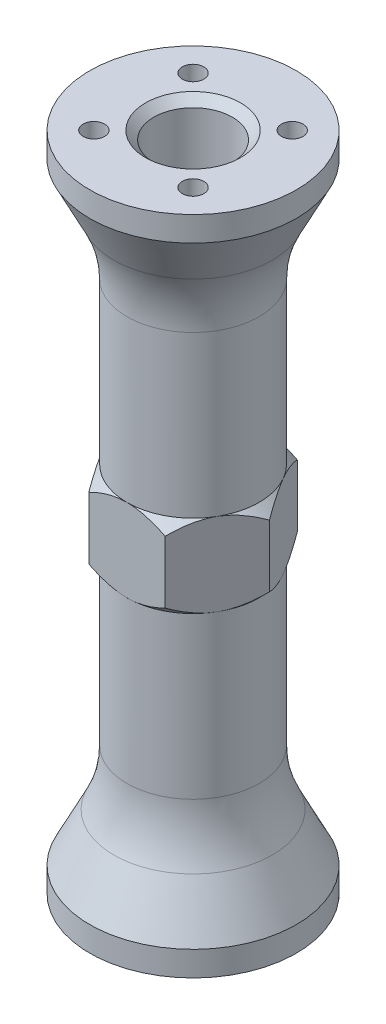
from build123d import *

# Parameters (mm, degrees)
SKETCH2_R           = 1.3
CUT_EXTRUDE1_DEPTH  = 7
SKETCH4_R           = 4.75
CUT_EXTRUDE2_DEPTH  = 82.929848041
FILLET1_R           = 15
FILLET2_R           = 4
SKETCH5_R           = 7
BOSS_EXTRUDE1_DEPTH = 5
CHAMFER1_SIZE       = 1


with BuildPart() as part:
    # Sketch1 → Revolve1 (revolve)
    with BuildSketch(Plane.XY, mode=Mode.PRIVATE) as revolve1_sk:
        Polygon((0, -40), (0, 40), (-12.5, 40), (-12.5, 37), (-8, 28), (-8, -28), (-12.5, -37), (-12.5, -40), align=None)
    revolve(revolve1_sk.sketch.rotate(Axis((0, -40, 0), (0, 1, 0)), 270), axis=Axis((0, -40, 0), (0, 1, 0)))

    # Sketch2 → Cut-Extrude1 (cut)
    with BuildSketch(Plane(origin=(0, 40, 0), x_dir=(1, 0, 0), z_dir=(0, 1, 0))):
        with Locations(Location((-6, 6, 0), (0, 0, 270))):
            Circle(SKETCH2_R)
        with Locations(Location((6, 6, 0), (0, 0, 270))):
            Circle(SKETCH2_R)
        with Locations(Location((-6, -6, 0), (0, 0, 270))):
            Circle(SKETCH2_R)
        with Locations(Location((6, -6, 0), (0, 0, 270))):
            Circle(SKETCH2_R)
    cut_extrude1 = extrude(amount=-CUT_EXTRUDE1_DEPTH, mode=Mode.SUBTRACT)

    # Mirror1: Cut-Extrude1 across plane
    add(cut_extrude1.mirror(Plane.ZX), mode=Mode.SUBTRACT)

    # Sketch3 → Cut-Revolve1 (revolve, cut)
    with BuildSketch(Plane(origin=(0, 0, 0), x_dir=(0, 0, -1), z_dir=(1, 0, 0))):
        Polygon((-5, 31.7), (0, 36.7), (0, -36.7), (-5, -31.7), align=None)
    revolve(axis=Axis((0, 36.7, 0), (0, -1, 0)), mode=Mode.SUBTRACT)

    # Sketch4 → Cut-Extrude2 (cut, through all)
    with BuildSketch(Plane(origin=(0, 40, 0), x_dir=(1, 0, 0), z_dir=(0, 1, 0))):
        with Locations(Location((0, 0, 0), (0, 0, 270))):
            Circle(SKETCH4_R)
    extrude(amount=-CUT_EXTRUDE2_DEPTH, mode=Mode.SUBTRACT)

    # Fillet1
    fillet1_edges = [part.edges().sort_by_distance(p)[0] for p in [
        (0, -28, 8),
        (0, 28, 8),
    ]]
    fillet(fillet1_edges, radius=FILLET1_R)

    # Fillet2
    # the kernel refuses this fillet: 4 mm, written as the material it adds along each edge
    with BuildSketch(Plane(origin=(0, 31.7, 0), x_dir=(0, 0, 1), z_dir=(1, 0, 0))) as fillet2_piece_1:
        with BuildLine():
            CenterArc((1, 1.141941091), FILLET2_R, 339.635865194, 20.364134806)
            Line((5, 1.141941091), (5.08, 1.141941091))
            Line((5.08, 1.141941091), (5.08, 0))
            Line((5.08, 0), (5.056568542, -0.056568542))
            ThreePointArc((5.056568542, -0.056568542), (4.931568542, -0.181568542), (4.825, -0.277838822))
            Line((4.825, -0.277838822), (4.75, -0.25))
        make_face()
    revolve(axis=Axis((0, 31.7, 0), (0, -1, 0)))
    with BuildSketch(Plane(origin=(0, -31.7, 0), x_dir=(0, 0, 1), z_dir=(1, 0, 0))) as fillet2_piece_2:
        with BuildLine():
            CenterArc((1, -1.141941091), FILLET2_R, 0, 20.364134806)
            Line((4.75, 0.25), (4.825, 0.277838822))
            ThreePointArc((4.825, 0.277838822), (4.931568542, 0.181568542), (5.056568542, 0.056568542))
            Line((5.056568542, 0.056568542), (5.08, 0))
            Line((5.08, 0), (5.08, -1.141941091))
            Line((5.08, -1.141941091), (5, -1.141941091))
        make_face()
    revolve(axis=Axis((0, -31.7, 0), (0, -1, 0)))

    # Sketch5 → Boss-Extrude1 (add, symmetric)
    with BuildSketch(Plane(origin=(0, 0, 0), x_dir=(1, 0, 0), z_dir=(0, 1, 0))):
        Polygon((4.618802154, 8), (-4.618802154, 8), (-9.237604307, 0), (-4.618802154, -8), (4.618802154, -8), (9.237604307, 0), align=None)
        Circle(SKETCH5_R, mode=Mode.SUBTRACT)
    extrude(amount=BOSS_EXTRUDE1_DEPTH, both=True)

    # Sketch6 → Cut-Revolve2 (revolve, cut)
    with BuildSketch(Plane.XY, mode=Mode.PRIVATE) as cut_revolve2_sk:
        Polygon((-8, 5), (-9.237604307, 3.762395693), (-9.237604307, 5), align=None)
    cut_revolve2 = revolve(cut_revolve2_sk.sketch.rotate(Axis((0, -40, 0), (0, -1, 0)), 270), axis=Axis((0, -40, 0), (0, -1, 0)), mode=Mode.SUBTRACT)

    # Mirror2: Cut-Revolve2 across plane
    add(cut_revolve2.mirror(Plane.ZX), mode=Mode.SUBTRACT)

    # Chamfer1
    chamfer1_edges = [part.edges().sort_by_distance(p)[0] for p in [
        (0, -40, -4.75),
        (0, 40, -4.75),
    ]]
    chamfer(chamfer1_edges, length=CHAMFER1_SIZE)


solid = part.part
